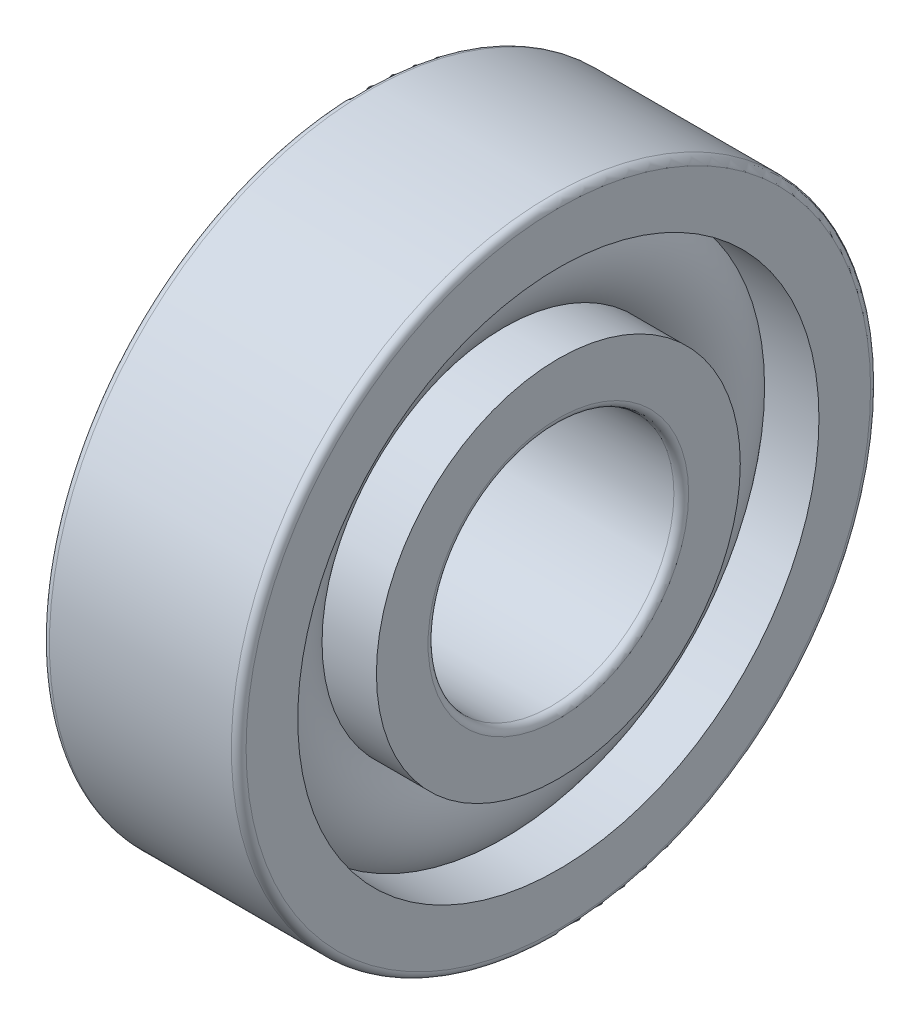
from build123d import *

# Parameters (mm, degrees)
CAGSPISKE_W     = 0.48
CAGSPISKE_H     = 0.8
CAGESPINE_ANGLE = 0.001
BALSIMSKE_R     = 2.4


with BuildPart() as part:
    # CagSpiSke → CageSpine (revolve)
    with BuildSketch(Plane.XY):
        with Locations((0, 9)):
            Rectangle(CAGSPISKE_W, CAGSPISKE_H)
    revolve(axis=Axis((-20.6375, 0, 0), (-1, 0, 0)), revolution_arc=CAGESPINE_ANGLE)

    # BalSimSke → BallsSimplified (revolve)
    with BuildSketch(Plane.XY):
        with Locations((0, 9)):
            Circle(BALSIMSKE_R)
    revolve(axis=Axis((-10, 0, 0), (1, 0, 0)))

    # InnRacSke → InnerRace (revolve)
    with BuildSketch(Plane.XY):
        with BuildLine():
            Line((-1.755170932, 7.4), (-4, 7.4))
            Line((-4, 7.4), (-4, 5.3))
            ThreePointArc((-4, 5.3), (-3.912132034, 5.087867966), (-3.7, 5))
            Line((-3.7, 5), (3.7, 5))
            ThreePointArc((3.7, 5), (3.912132034, 5.087867966), (4, 5.3))
            Line((4, 5.3), (4, 7.4))
            Line((4, 7.4), (1.755170932, 7.4))
            ThreePointArc((1.755170932, 7.4), (0, 6.625), (-1.755170932, 7.4))
        make_face()
    revolve(axis=Axis((-20.6375, 0, 0), (1, 0, 0)))

    # OutRacSke → OuterRace (revolve)
    with BuildSketch(Plane.XY):
        with BuildLine():
            Line((-1.755170932, 10.6), (-4, 10.6))
            Line((-4, 10.6), (-4, 12.7))
            ThreePointArc((-4, 12.7), (-3.912132034, 12.912132034), (-3.7, 13))
            Line((-3.7, 13), (3.7, 13))
            ThreePointArc((3.7, 13), (3.912132034, 12.912132034), (4, 12.7))
            Line((4, 12.7), (4, 10.6))
            Line((4, 10.6), (1.755170932, 10.6))
            ThreePointArc((1.755170932, 10.6), (0, 11.375), (-1.755170932, 10.6))
        make_face()
    revolve(axis=Axis((-20.6375, 0, 0), (1, 0, 0)))


solid = part.part
